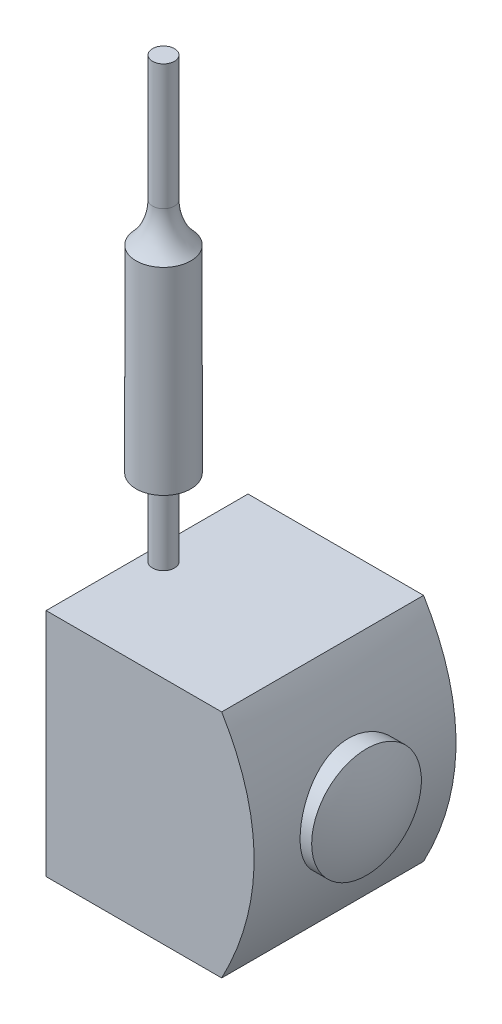
from build123d import *

# Parameters (mm, degrees)
BOSS_EXTRUDE1_DEPTH = 18.4
SKETCH2_R           = 5
BOSS_EXTRUDE2_DEPTH = 20
DOME1_FACE_RADIUS   = 5
DOME1_HEIGHT        = 1
SKETCH3_R           = 1
BOSS_EXTRUDE3_DEPTH = 40
BOSS_EXTRUDE4_START = -15
SKETCH4_R           = 2.5
BOSS_EXTRUDE4_DEPTH = 18
FILLET1_R           = 5


with BuildPart() as part:
    # Sketch1 → Boss-Extrude1 (new body)
    with BuildSketch(Plane.XY):
        with BuildLine():
            Line((-17.563883718, 9.91167305), (-1.563883718, 9.91167305))
            add(Edge.make_bspline(
                [(-1.563883718, 9.91167305), (4.3404042, 0.119497618), (-1.563883718, -11.08832695)],
                knots=[0, 0, 0, 1, 1, 1], degree=2))
            Line((-1.563883718, -11.08832695), (-17.563883718, -11.08832695))
            Line((-17.563883718, -11.08832695), (-17.563883718, 9.91167305))
        make_face()
    extrude(amount=BOSS_EXTRUDE1_DEPTH)

    # Sketch2 → Boss-Extrude2 (add)
    with BuildSketch(Plane.ZY.offset(17.563883718)):
        with Locations((9.2, -0.58832695)):
            Circle(SKETCH2_R)
    extrude(amount=-BOSS_EXTRUDE2_DEPTH)

    # Dome1: a dome of height H over a round flat face of radius A is a cap of a sphere of radius (A * A + H * H) / (2 * H)
    dome1_r = (DOME1_FACE_RADIUS * DOME1_FACE_RADIUS + DOME1_HEIGHT * DOME1_HEIGHT) / (2 * DOME1_HEIGHT)
    dome1_base = Plane((2.436116282, -0.58832695, 9.2), z_dir=(1, 0, 0))
    with Locations(dome1_base.offset(DOME1_HEIGHT - dome1_r)):
        dome1_ball = Sphere(dome1_r, mode=Mode.PRIVATE)
    add(split(dome1_ball, bisect_by=dome1_base, keep=Keep.TOP, mode=Mode.PRIVATE))

    # Sketch3 → Boss-Extrude3 (add)
    with BuildSketch(Plane(origin=(0, 9.91167305, 0), x_dir=(1, 0, 0), z_dir=(0, 1, 0))):
        with Locations(Location((-16.067507499, -9.2, 0), (0, 0, 90))):
            Circle(SKETCH3_R)
    extrude(amount=BOSS_EXTRUDE3_DEPTH)

    # Sketch4 → Boss-Extrude4 (add)
    with BuildSketch(Plane(origin=(0, 49.91167305, 0), x_dir=(1, 0, 0), z_dir=(0, 1, 0)).offset(BOSS_EXTRUDE4_START)):
        with Locations(Location((-16.067507499, -9.2, 0), (0, 0, 270))):
            Circle(SKETCH4_R)
    extrude(amount=-BOSS_EXTRUDE4_DEPTH)

    # Fillet1
    # the kernel refuses this fillet: 5 mm, written as the material it adds along each edge
    with BuildSketch(Plane(origin=(-16.067507499, 34.91167305, 9.2), x_dir=(0, 0, -1), z_dir=(-1, 0, 0))) as fillet1_piece_1:
        with BuildLine():
            CenterArc((6, -3.570714214), FILLET1_R, 134.427004001, 45.572995999)
            Line((1, -3.570714214), (0.9, -3.570714214))
            Line((0.9, -3.570714214), (0.9, 0))
            Line((0.9, 0), (1, 0.1))
            ThreePointArc((1, 0.1), (1.75, 0.1), (2.43, 0.071414284))
            Line((2.43, 0.071414284), (2.5, 0))
        make_face()
    revolve(axis=Axis((-16.067507499, 34.91167305, 9.2), (0, -1, 0)))


solid = part.part
